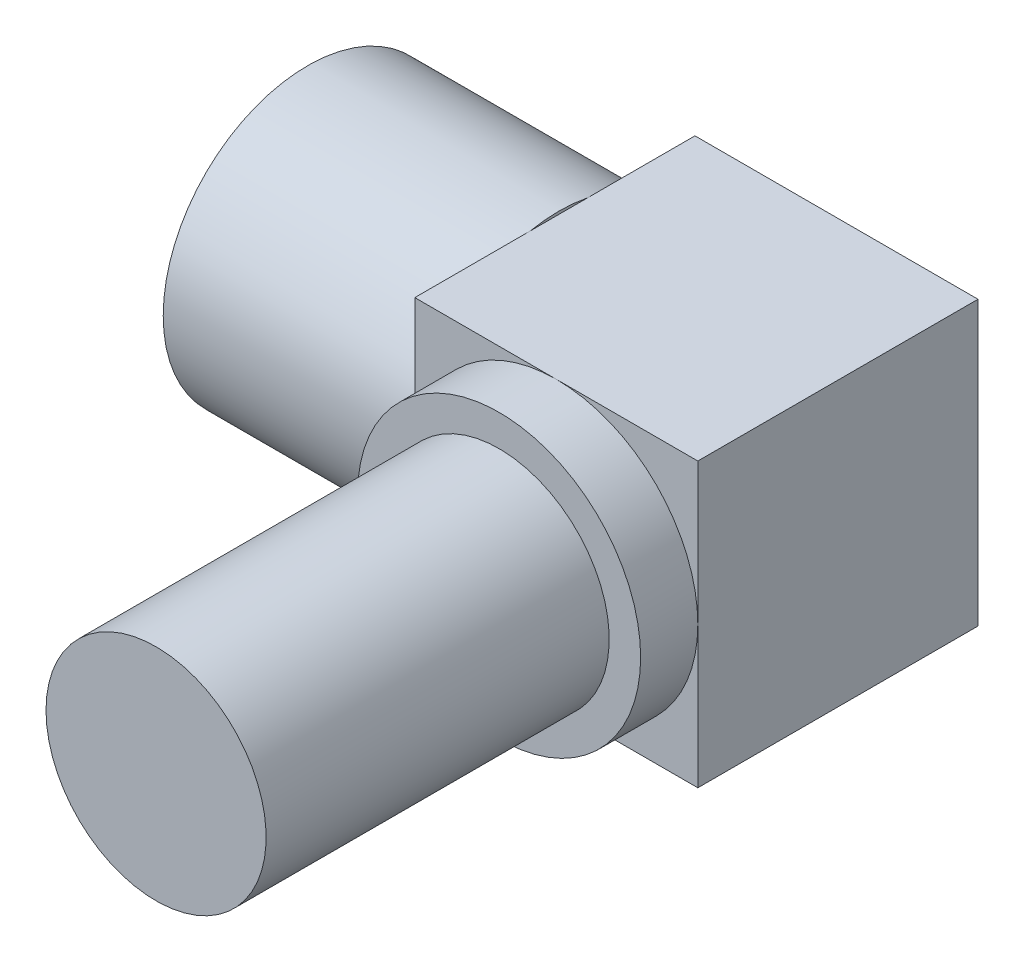
from build123d import *

# Parameters (mm, degrees)
SKETCH1_W           = 25.146
SKETCH1_H           = 25.146
BOSS_EXTRUDE1_DEPTH = 24.892
SKETCH2_R           = 12.573
BOSS_EXTRUDE2_DEPTH = 5.08
SKETCH3_R           = 9.779
BOSS_EXTRUDE3_DEPTH = 30.48
SKETCH4_R           = 12.827
BOSS_EXTRUDE4_DEPTH = 22.352


with BuildPart() as part:
    # Sketch1 → Boss-Extrude1 (new body)
    with BuildSketch(Plane.XY):
        with Locations((-15.408088235, -0.246529412)):
            Rectangle(SKETCH1_W, SKETCH1_H)
    extrude(amount=BOSS_EXTRUDE1_DEPTH)

    # Sketch2 → Boss-Extrude2 (add)
    with BuildSketch(Plane.XY.offset(24.892)):
        with Locations((-15.408088235, -0.246529412)):
            Circle(SKETCH2_R)
    extrude(amount=BOSS_EXTRUDE2_DEPTH)

    # Sketch3 → Boss-Extrude3 (add)
    with BuildSketch(Plane.XY.offset(29.972)):
        with Locations((-15.408088235, -0.246529412)):
            Circle(SKETCH3_R)
    extrude(amount=BOSS_EXTRUDE3_DEPTH)

    # Sketch4 → Boss-Extrude4 (add)
    with BuildSketch(Plane.ZY.offset(27.981088235)):
        with Locations((12.065, -0.246529412)):
            Circle(SKETCH4_R)
    extrude(amount=BOSS_EXTRUDE4_DEPTH)


solid = part.part
